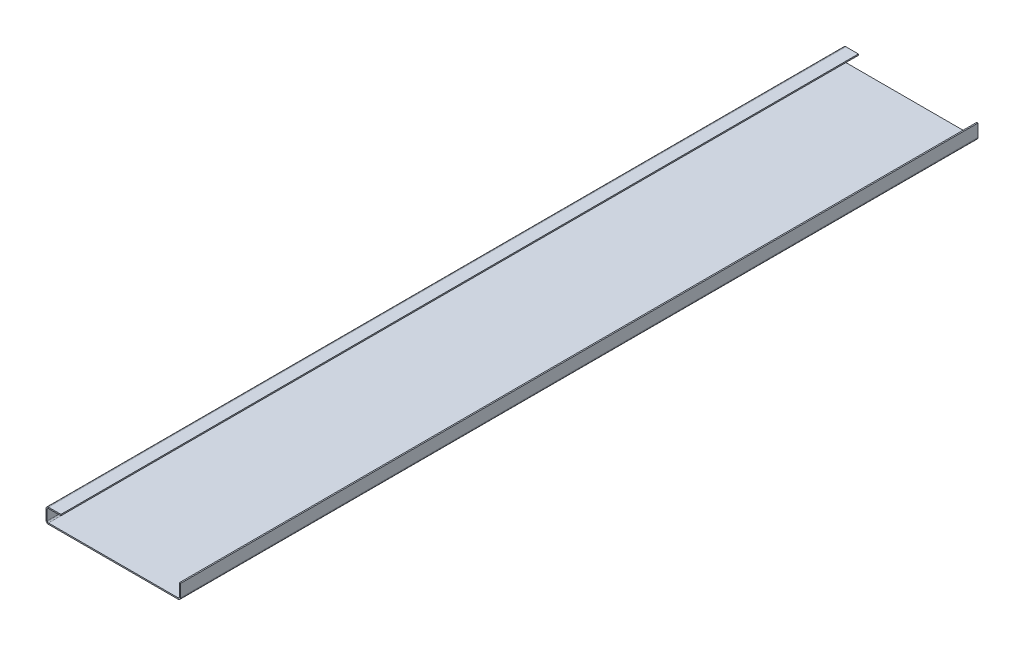
from build123d import *

# Parameters (mm, degrees)
TABAN_FLAN_1_DEPTH = 1600


# Sheet-metal steps are written as plain solids
with BuildPart() as part:
    # Çizim1 → Taban-Flanş1 (new body)
    with BuildSketch(Plane.XY):
        with BuildLine():
            Line((0, 0), (-25, 0))
            ThreePointArc((-25, 0), (-28.535533906, -1.464466094), (-30, -5))
            Line((-30, -5), (-30, -25))
            ThreePointArc((-30, -25), (-28.535533906, -28.535533906), (-25, -30))
            Line((-25, -30), (235, -30))
            ThreePointArc((235, -30), (238.535533906, -28.535533906), (240, -25))
            Line((240, -25), (240, 0))
            Line((240, 0), (237.5, 0))
            Line((237.5, 0), (237.5, -25))
            ThreePointArc((237.5, -25), (236.767766953, -26.767766953), (235, -27.5))
            Line((235, -27.5), (-25, -27.5))
            ThreePointArc((-25, -27.5), (-26.767766953, -26.767766953), (-27.5, -25))
            Line((-27.5, -25), (-27.5, -5))
            ThreePointArc((-27.5, -5), (-26.767766953, -3.232233047), (-25, -2.5))
            Line((-25, -2.5), (0, -2.5))
            Line((0, -2.5), (0, 0))
        make_face()
    extrude(amount=TABAN_FLAN_1_DEPTH)


solid = part.part
